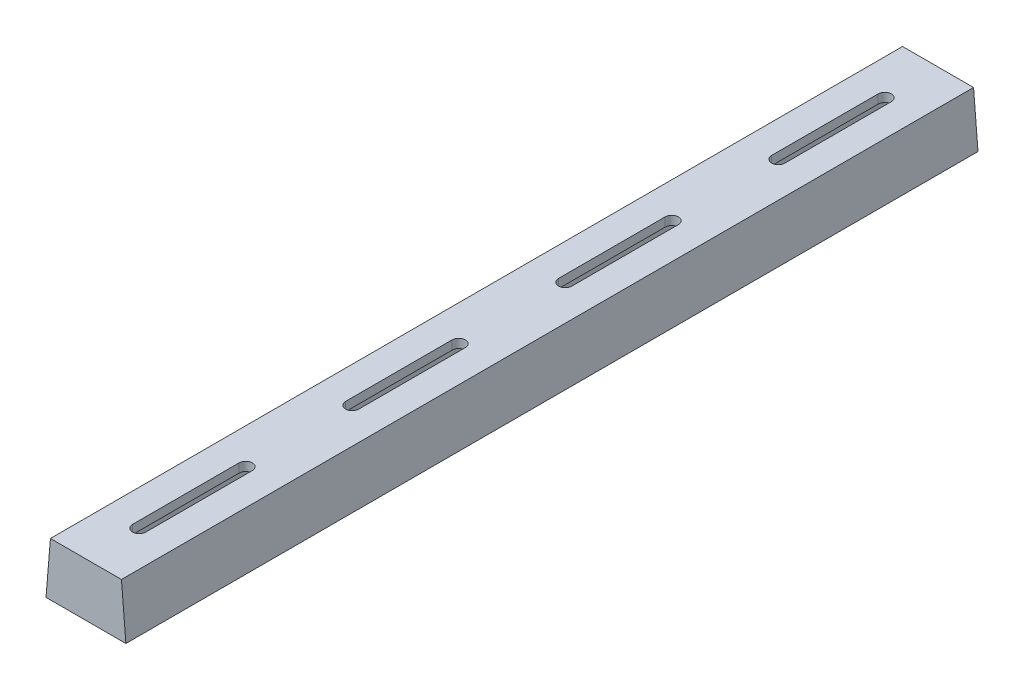
from build123d import *

# Parameters (mm, degrees)
BOSS_EXTRUDE1_DEPTH  = 304.8
SHELL1_T             = -6.35
CUT_EXTRUDE1_DEPTH   = 309.49826681
RIB2_START           = -22.202989535
RIB2_DEPTH           = 44.40597907
LPATTERN1_COUNT      = 3
LPATTERN1_PITCH      = 152.4
LPATTERN2_COUNT      = 2
LPATTERN2_PITCH      = 152.4
MIRROR1_COPY_1_DEPTH = 309.49826681


# Read off the part's stored shape, not the designer's step: Rib2
with BuildPart() as part:
    # Sketch1 → Boss-Extrude1 (new, symmetric)
    with BuildSketch(Plane.XY):
        Polygon((28.575, -38.1), (-28.575, -38.1), (-25.4, 0), (25.4, 0), align=None)
    extrude(amount=BOSS_EXTRUDE1_DEPTH, both=True)

    # Shell1
    shell1_openings = [part.faces().sort_by_distance(p)[0] for p in [
        (0, -38.1, 0),
    ]]
    offset(amount=SHELL1_T, openings=shell1_openings, kind=Kind.INTERSECTION)

    # Sketch2 → Cut-Extrude1 (cut, symmetric)
    with BuildSketch(Plane(origin=(0, 0, 0), x_dir=(1, 0, 0), z_dir=(0, 1, 0))):
        with BuildLine():
            Line((4.7625, -38.1), (4.7625, -114.3))
            ThreePointArc((4.7625, -114.3), (0, -119.0625), (-4.7625, -114.3))
            Line((-4.7625, -114.3), (-4.7625, -38.1))
            ThreePointArc((-4.7625, -38.1), (0, -33.3375), (4.7625, -38.1))
        make_face()
    cut_extrude1 = extrude(amount=CUT_EXTRUDE1_DEPTH, both=True, mode=Mode.SUBTRACT)

    # Rib2 outline → Rib2 (add)
    with BuildSketch(Plane.YZ.offset(RIB2_START)):
        Polygon((-6.35, 146.447234933), (-6.35, 158.352765067), (-38.1, 155.575), (-38.1, 149.225), align=None)
    rib2 = extrude(amount=RIB2_DEPTH)

    # LPattern1: Rib2 ×3
    with Locations(*[(0, 0, -i * LPATTERN1_PITCH) for i in range(1, LPATTERN1_COUNT)]):
        add(rib2)

    # LPattern2: Cut-Extrude1 ×2
    with Locations(*[(0, 0, i * LPATTERN2_PITCH) for i in range(1, LPATTERN2_COUNT)]):
        add(cut_extrude1, mode=Mode.SUBTRACT)

    # Mirror1: Cut-Extrude1 across plane
    add(cut_extrude1.mirror(Plane.XY), mode=Mode.SUBTRACT)

    # Mirror1 copy 1 sketch → Mirror1 copy 1 (cut, symmetric)
    with BuildSketch(Plane(origin=(0, 0, -152.4), x_dir=(1, 0, 0), z_dir=(0, 1, 0))):
        with BuildLine():
            Line((4.7625, 38.1), (4.7625, 114.3))
            ThreePointArc((4.7625, 114.3), (0, 119.0625), (-4.7625, 114.3))
            Line((-4.7625, 114.3), (-4.7625, 38.1))
            ThreePointArc((-4.7625, 38.1), (0, 33.3375), (4.7625, 38.1))
        make_face()
    extrude(amount=MIRROR1_COPY_1_DEPTH, both=True, mode=Mode.SUBTRACT)


solid = part.part
